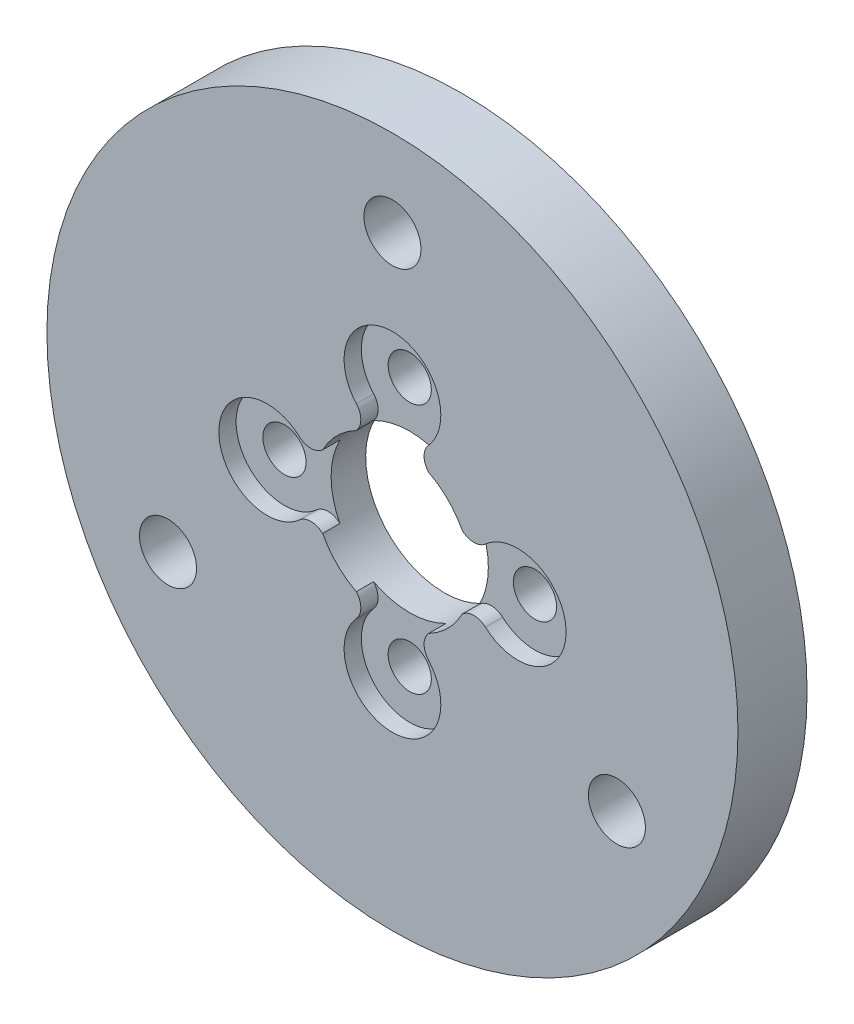
from build123d import *
from build123d.topology import SkipClean

# Parameters (mm, degrees)
SKETCH_1_R          = 20
SKETCH_1_R_2        = 4.55
EXTRUDE_1_DEPTH     = 3
SKETCH_4_R          = 1.25
CUT_EXTRUDE_3_DEPTH = 11
SKETCH_5_R          = 1.25
CUT_EXTRUDE_4_DEPTH = 1
SKETCH_7_R          = 20
SKETCH_7_R_2        = 9.5
EXTRUDE_2_DEPTH     = 1
EXTRUDE_START       = 0.2
SKETCH_9_R          = 20
SKETCH_9_R_2        = 9.5
EXTRUDE_3_DEPTH     = 0.2
SKETCH_10_R         = 19.25
SKETCH_10_R_2       = 17.25
CUT_EXTRUDE_6_DEPTH = 1
FILLET_1_R          = 1
SKETCH_11_R         = 20
CUT_EXTRUDE_7_DEPTH = 0.2
SKETCH_13_R         = 1.65
CUT_EXTRUDE_8_DEPTH = 29.565713714


with BuildPart() as part:
    # 草图1 → 凸台-拉伸1 (new body)
    with BuildSketch(Plane.XY):
        Circle(SKETCH_1_R)
        Circle(SKETCH_1_R_2, mode=Mode.SUBTRACT)
    extrude(amount=EXTRUDE_1_DEPTH)

    # 草图4 → 切除-拉伸3 (cut)
    with BuildSketch(Plane.XY.offset(3)):
        with Locations((0, 7.25)):
            Circle(SKETCH_4_R)
        with Locations((7.25, 0)):
            Circle(SKETCH_4_R)
        with Locations((0, -7.25)):
            Circle(SKETCH_4_R)
        with Locations((-7.25, 0)):
            Circle(SKETCH_4_R)
    extrude(amount=-CUT_EXTRUDE_3_DEPTH, mode=Mode.SUBTRACT)

    # 草图5 → 切除-拉伸4 (cut)
    with BuildSketch(Plane.XY.offset(3)):
        with BuildLine():
            ThreePointArc((-5.382359347, 2.08612521), (-10.05, 0), (-5.382359347, -2.08612521))
            ThreePointArc((-5.382359347, -2.08612521), (-4.565967837, -1.842389611), (-3.858009404, -2.316411759))
            ThreePointArc((-3.858009404, -2.316411759), (-3.181980515, -3.181980515), (-2.316411759, -3.858009404))
            ThreePointArc((-2.316411759, -3.858009404), (-1.842389611, -4.565967837), (-2.08612521, -5.382359347))
            ThreePointArc((-2.08612521, -5.382359347), (0, -10.05), (2.08612521, -5.382359347))
            ThreePointArc((2.08612521, -5.382359347), (1.842389611, -4.565967837), (2.316411759, -3.858009404))
            ThreePointArc((2.316411759, -3.858009404), (3.181980515, -3.181980515), (3.858009404, -2.316411759))
            ThreePointArc((3.858009404, -2.316411759), (4.565967837, -1.842389611), (5.382359347, -2.08612521))
            ThreePointArc((5.382359347, -2.08612521), (10.05, 0), (5.382359347, 2.08612521))
            ThreePointArc((5.382359347, 2.08612521), (4.565967837, 1.842389611), (3.858009404, 2.316411759))
            ThreePointArc((3.858009404, 2.316411759), (3.181980515, 3.181980515), (2.316411759, 3.858009404))
            ThreePointArc((2.316411759, 3.858009404), (1.842389611, 4.565967837), (2.08612521, 5.382359347))
            ThreePointArc((2.08612521, 5.382359347), (0, 10.05), (-2.08612521, 5.382359347))
            ThreePointArc((-2.08612521, 5.382359347), (-1.842389611, 4.565967837), (-2.316411759, 3.858009404))
            ThreePointArc((-2.316411759, 3.858009404), (-3.181980515, 3.181980515), (-3.858009404, 2.316411759))
            ThreePointArc((-3.858009404, 2.316411759), (-4.565967837, 1.842389611), (-5.382359347, 2.08612521))
        make_face()
        with Locations((0, -7.25)):
            Circle(SKETCH_5_R, mode=Mode.SUBTRACT)
        with Locations((-7.25, 0)):
            Circle(SKETCH_5_R, mode=Mode.SUBTRACT)
        with Locations((7.25, 0)):
            Circle(SKETCH_5_R, mode=Mode.SUBTRACT)
        with Locations((0, 7.25)):
            Circle(SKETCH_5_R, mode=Mode.SUBTRACT)
    extrude(amount=-CUT_EXTRUDE_4_DEPTH, mode=Mode.SUBTRACT)

    # 草图7 → 凸台-拉伸2 (add, symmetric)
    with SkipClean():  # the faces are left unmerged after this step: merging them gives an invalid solid
        with BuildSketch(Plane(origin=(0, 0, 0), x_dir=(-1, 0, 0), z_dir=(0, 0, -1))):
            Circle(SKETCH_7_R)
            with Locations(Location((0, 0, 0), (0, 0, 180))):
                Circle(SKETCH_7_R_2, mode=Mode.SUBTRACT)
        extrude(amount=EXTRUDE_2_DEPTH, both=True)

    # 草图9 → 凸台-拉伸3 (add)
    with BuildSketch(Plane(origin=(0, 0, -1), x_dir=(-1, 0, 0), z_dir=(0, 0, -1)).offset(EXTRUDE_START)):
        Circle(SKETCH_9_R)
        with Locations(Location((0, 0, 0), (0, 0, 180))):
            Circle(SKETCH_9_R_2, mode=Mode.SUBTRACT)
    extrude(amount=-EXTRUDE_3_DEPTH)

    # 草图10 → 切除-拉伸6 (cut)
    with BuildSketch(Plane(origin=(0, 0, -1.2), x_dir=(-1, 0, 0), z_dir=(0, 0, -1))):
        Circle(SKETCH_10_R)
        Circle(SKETCH_10_R_2, mode=Mode.SUBTRACT)
    extrude(amount=-CUT_EXTRUDE_6_DEPTH, mode=Mode.SUBTRACT)

    # 圆角1
    fillet_1_edges = [part.edges().sort_by_distance(p)[0] for p in [
        (19.25, 0, -0.2),
        (17.25, 0, -0.2),
    ]]
    fillet(fillet_1_edges, radius=FILLET_1_R - 0.0001)  # a hair under: the kernel refuses the full size

    # 草图11 → 切除-拉伸7 (cut)
    with BuildSketch(Plane(origin=(0, 0, -1.2), x_dir=(-1, 0, 0), z_dir=(0, 0, -1))):
        Circle(SKETCH_11_R)
    extrude(amount=-CUT_EXTRUDE_7_DEPTH, mode=Mode.SUBTRACT)

    # 草图13 → 切除-拉伸8 (cut, through all)
    with BuildSketch(Plane(origin=(0, 0, -1), x_dir=(-1, 0, 0), z_dir=(0, 0, -1))):
        with Locations((0, 15)):
            Circle(SKETCH_13_R)
        with Locations((12.990381057, -7.5)):
            Circle(SKETCH_13_R)
        with Locations((-12.990381057, -7.5)):
            Circle(SKETCH_13_R)
    extrude(amount=-CUT_EXTRUDE_8_DEPTH, mode=Mode.SUBTRACT)


solid = part.part
